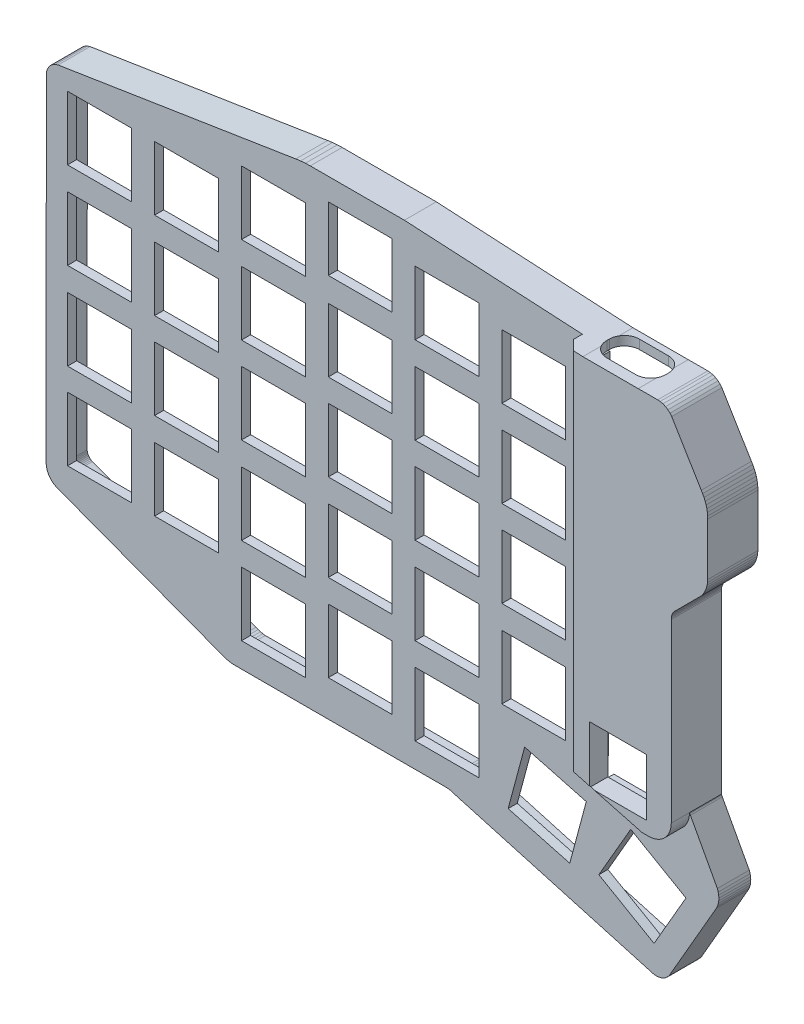
from build123d import *

# Parameters (mm, degrees)
CONTOUR_DEPTH          = 2
CONTOUR_DEPTH_BACK     = 5
ESQUISSE2_W            = 16.1
ESQUISSE2_H            = 14.1
ESQUISSE2_W_2          = 14
ESQUISSE2_H_2          = 14
ESQUISSE2_W_3          = 14.025441
PLATEAU_DEPTH          = 2
ENLEV_PSOM_DEPTH       = 2
ENLEV_START            = -0.5
ESQUISSE4_W            = 8
ESQUISSE4_H            = 8
ENLEV_SR_DEPTH         = 181.12573089
ENLEV_USB_DEPTH        = 10
ESQUISSE9_W            = 12.5
ESQUISSE9_H            = 12.5
BOSS_EXTRU_1_DEPTH     = 4
ENLEV_USB_2_DEPTH      = 2
ENLEV_USB_2_DEPTH_BACK = 2
ESQUISSE8_W            = 12.3
ESQUISSE8_H            = 7.2
ENLEV_USB_3_DEPTH      = 2
CHANFREIN1_SIZE        = 2


with BuildPart() as part:
    # Esquisse1 → Contour (new, two sides: drawn at the far end of the back side and taken through both)
    with BuildSketch(Plane.XY.offset(1.58).offset(-CONTOUR_DEPTH_BACK)):
        Polygon((-0.070669069, -78.010400076), (35.891181454, -91.546056984), (36.410466692, -91.772415512), (37.093081584, -91.996688133), (37.793675302, -92.156155293), (38.544269443, -92.254417), (85.559404107, -92.254417), (85.877019494, -92.291366072), (86.239984785, -92.359141634), (86.597404622, -92.451698185), (87.062965798, -92.607121854), (130.86251782, -104.975260433), (131.43389169, -105.033093447), (131.994682702, -104.998446027), (132.542465338, -104.873481826), (133.062796424, -104.661502855), (133.541959027, -104.368091177), (133.967370901, -104.000936506), (134.335210756, -103.560758555), (144.734398643, -85.501681055), (144.949646628, -85.009048728), (145.107093294, -84.483870396), (145.200181585, -83.943565594), (145.227558424, -83.395976689), (145.18882232, -82.849072108), (145.084548391, -82.310863798), (144.896135329, -81.72665786), (138.983739314, -70.76833766), (138.852004091, -70.547015883), (138.810158784, -70.455662307), (138.781143, -70.368736334), (138.781143, -31.647833224), (138.795598839, -31.333548136), (138.832202844, -31.069781849), (138.892866137, -30.810487886), (138.977076259, -30.557858099), (139.084122245, -30.314024401), (139.213099553, -30.081048074), (139.305959271, -29.94459521), (145.382897496, -23.867656985), (145.765390331, -23.341253838), (146.062952091, -22.83813426), (146.311833426, -22.309238734), (146.509825283, -21.759263203), (146.65516711, -21.193092489), (146.746570537, -20.615755138), (146.781143, -20.065465237), (146.781143, -8.577539054), (146.768717011, -7.985190432), (146.705324445, -7.337390513), (146.592563495, -6.696337408), (146.431093228, -6.065790435), (146.221862613, -5.449443714), (145.966095227, -4.850906853), (145.665297611, -4.273701659), (145.371606939, -3.802084291), (138.873582537, 6.969270257), (138.501879109, 7.430251399), (138.038800394, 7.843967596), (137.514705619, 8.177029924), (136.943495806, 8.420600285), (136.340315392, 8.568220772), (135.807638993, 8.609297951), (131.513464945, 8.592943), (129.917464, 8.592943), (120.917464, 8.592943), (119.374655601, 8.592943), (76.213775601, 10.945583), (55.546780356, 10.945583), (54.487809548, 10.910917492), (53.412263261, 10.82000144), (52.375252365, 10.678150275), (0.212293698, 2.452452946), (-0.337448162, 2.286696078), (-0.896715628, 1.992876271), (-1.390081178, 1.59827241), (-1.799609576, 1.117233202), (-2.110431737, 0.567226717), (-2.311289019, -0.031881124), (-2.386546014, -0.596632339), (-2.413633698, -74.604297371), (-2.36544505, -75.107796481), (-2.232957994, -75.649095831), (-2.023839154, -76.165648062), (-1.742460222, -76.646668805), (-1.394690715, -77.082115184), (-0.987799519, -77.462892806), (-0.530080186, -77.781190629), align=None)
        Polygon((-0.386594572, -0.729667254), (-0.413598748, -74.509173208), (-0.388345002, -74.773036975), (-0.324744666, -75.032887421), (-0.224357103, -75.280858479), (-0.089280963, -75.5117728), (0.077666156, -75.720809294), (0.272995261, -75.903602515), (0.492639991, -76.056343363), (0.73014814, -76.174840956), (36.643525784, -89.69225319), (37.123753652, -89.901586453), (37.628328647, -90.067364197), (38.146192157, -90.185238823), (38.674625212, -90.254417), (85.67534591, -90.254417), (86.176481881, -90.312715527), (86.674742133, -90.405754364), (87.165426887, -90.532820866), (87.65170599, -90.695161041), (131.237818944, -103.003028592), (131.473188176, -103.026852069), (131.708718224, -103.012300287), (131.938786921, -102.959815325), (132.157326496, -102.870783945), (132.358573287, -102.747551961), (132.537221471, -102.593368405), (132.68889956, -102.411861836), (142.946003745, -84.599524812), (143.068580316, -84.318987082), (143.156642538, -84.025247162), (143.208708647, -83.723044076), (143.224020877, -83.416770319), (143.202355349, -83.110880577), (143.144028019, -82.809824943), (143.048943587, -82.514999898), (137.243591396, -71.755079889), (137.078439242, -71.477615994), (136.947084704, -71.190852491), (136.847216761, -70.891666428), (136.781143, -70.588782336), (136.781143, -31.601861582), (136.80193804, -31.149755626), (136.863832516, -30.703747707), (136.966408864, -30.265304185), (137.108800774, -29.838129433), (137.289805821, -29.425828781), (137.507895217, -29.031886099), (137.758515203, -28.663612153), (143.857417024, -22.564710333), (144.091957635, -22.241925421), (144.293469147, -21.901208298), (144.462013973, -21.543035178), (144.59609549, -21.170587772), (144.694522243, -20.787172023), (144.756421454, -20.396194054), (144.781143, -20.002701202), (144.781143, -8.598514241), (144.770763667, -8.103730021), (144.722293545, -7.608420501), (144.636076357, -7.118270353), (144.512615868, -6.636152878), (144.352637267, -6.164891605), (144.157076916, -5.707248898), (143.927081791, -5.265907698), (143.666403188, -4.847302109), (137.231311549, 5.819732869), (137.047533291, 6.047651971), (136.828173352, 6.243628933), (136.579909791, 6.401400473), (136.309329324, 6.516779061), (136.0236074, 6.586705751), (135.734441857, 6.609004664), (131.517273569, 6.592943), (129.917464, 6.592943), (120.917464, 6.592943), (119.32018741, 6.592943), (76.15930741, 8.945583), (55.579506684, 8.945583), (54.60483474, 8.913677023), (53.63216587, 8.831457211), (52.666576779, 8.699375727), (0.658816843, 0.498152045), (0.423228183, 0.427117908), (0.202969732, 0.311401727), (0.008667563, 0.155994877), (-0.152618551, -0.033454609), (-0.275030083, -0.250064442), (-0.354120429, -0.485971482), align=None, mode=Mode.SUBTRACT)
    extrude(amount=CONTOUR_DEPTH + CONTOUR_DEPTH_BACK)

    # Esquisse2 → Plateau (add)
    with BuildSketch(Plane.XY.offset(1.58)):
        Polygon((-0.386594572, -0.729667254), (-0.413598748, -74.509173208), (-0.388345002, -74.773036975), (-0.324744666, -75.032887421), (-0.224357103, -75.280858479), (-0.089280963, -75.5117728), (0.077666156, -75.720809294), (0.272995261, -75.903602515), (0.492639991, -76.056343363), (0.73014814, -76.174840956), (36.643525784, -89.69225319), (37.123753652, -89.901586453), (37.628328647, -90.067364197), (38.146192157, -90.185238823), (38.674625212, -90.254417), (85.67534591, -90.254417), (86.176481881, -90.312715527), (86.674742133, -90.405754364), (87.165426887, -90.532820866), (87.65170599, -90.695161041), (131.237818944, -103.003028592), (131.473188176, -103.026852069), (131.708718224, -103.012300287), (131.938786921, -102.959815325), (132.157326496, -102.870783945), (132.358573287, -102.747551961), (132.537221471, -102.593368405), (132.68889956, -102.411861836), (142.946003745, -84.599524812), (143.068580316, -84.318987082), (143.156642538, -84.025247162), (143.208708647, -83.723044076), (143.224020877, -83.416770319), (143.202355349, -83.110880577), (143.144028019, -82.809824943), (143.048943587, -82.514999898), (137.243591396, -71.755079889), (137.078439242, -71.477615994), (136.947084704, -71.190852491), (136.847216761, -70.891666428), (136.781143, -70.588782336), (136.781143, -31.601861582), (136.80193804, -31.149755626), (136.863832516, -30.703747707), (136.966408864, -30.265304185), (137.108800774, -29.838129433), (137.289805821, -29.425828781), (137.507895217, -29.031886099), (137.758515203, -28.663612153), (143.857417024, -22.564710333), (144.091957635, -22.241925421), (144.293469147, -21.901208298), (144.462013973, -21.543035178), (144.59609549, -21.170587772), (144.694522243, -20.787172023), (144.756421454, -20.396194054), (144.781143, -20.002701202), (144.781143, -8.598514241), (144.770763667, -8.103730021), (144.722293545, -7.608420501), (144.636076357, -7.118270353), (144.512615868, -6.636152878), (144.352637267, -6.164891605), (144.157076916, -5.707248898), (143.927081791, -5.265907698), (143.666403188, -4.847302109), (137.231311549, 5.819732869), (137.047533291, 6.047651971), (136.828173352, 6.243628933), (136.579909791, 6.401400473), (136.309329324, 6.516779061), (136.0236074, 6.586705751), (135.734441857, 6.609004664), (131.517273569, 6.592943), (119.32018741, 6.592943), (76.15930741, 8.945583), (55.579506684, 8.945583), (54.60483474, 8.913677023), (53.63216587, 8.831457211), (52.666576779, 8.699375727), (0.658816843, 0.498152045), (0.423228183, 0.427117908), (0.202969732, 0.311401727), (0.008667563, 0.155994877), (-0.152618551, -0.033454609), (-0.275030083, -0.250064442), (-0.354120429, -0.485971482), align=None)
        with Locations((127.106143, -66.299563)):
            Rectangle(ESQUISSE2_W, ESQUISSE2_H, mode=Mode.SUBTRACT)
        with Locations((9.281143, -8.499563)):
            Rectangle(ESQUISSE2_W_2, ESQUISSE2_H_2, mode=Mode.SUBTRACT)
        with Locations((28.3938635, -8.499563)):
            Rectangle(ESQUISSE2_W_3, ESQUISSE2_H_2, mode=Mode.SUBTRACT)
        with Locations((28.3938635, -27.604417)):
            Rectangle(ESQUISSE2_W_3, ESQUISSE2_H_2, mode=Mode.SUBTRACT)
        with Locations((9.281143, -27.604417)):
            Rectangle(ESQUISSE2_W_2, ESQUISSE2_H_2, mode=Mode.SUBTRACT)
        with Locations((9.281143, -46.749563)):
            Rectangle(ESQUISSE2_W_2, ESQUISSE2_H_2, mode=Mode.SUBTRACT)
        with Locations((28.381143, -46.599563)):
            Rectangle(ESQUISSE2_W_2, ESQUISSE2_H_2, mode=Mode.SUBTRACT)
        with Locations((28.3938635, -65.704417)):
            Rectangle(ESQUISSE2_W_3, ESQUISSE2_H_2, mode=Mode.SUBTRACT)
        with Locations((9.281143, -65.699563)):
            Rectangle(ESQUISSE2_W_2, ESQUISSE2_H_2, mode=Mode.SUBTRACT)
        with Locations((47.456584, -60.804417)):
            Rectangle(ESQUISSE2_W_2, ESQUISSE2_H_2, mode=Mode.SUBTRACT)
        with Locations((47.456584, -79.854417)):
            Rectangle(ESQUISSE2_W_2, ESQUISSE2_H_2, mode=Mode.SUBTRACT)
        with Locations((47.456584, -41.699563)):
            Rectangle(ESQUISSE2_W_2, ESQUISSE2_H_2, mode=Mode.SUBTRACT)
        with Locations((47.456584, -22.699563)):
            Rectangle(ESQUISSE2_W_2, ESQUISSE2_H_2, mode=Mode.SUBTRACT)
        with Locations((47.456584, -3.599563)):
            Rectangle(ESQUISSE2_W_2, ESQUISSE2_H_2, mode=Mode.SUBTRACT)
        with Locations((66.506584, -0.899563)):
            Rectangle(ESQUISSE2_W_2, ESQUISSE2_H_2, mode=Mode.SUBTRACT)
        with Locations((66.506584, -20.199563)):
            Rectangle(ESQUISSE2_W_2, ESQUISSE2_H_2, mode=Mode.SUBTRACT)
        with Locations((66.506584, -39.199563)):
            Rectangle(ESQUISSE2_W_2, ESQUISSE2_H_2, mode=Mode.SUBTRACT)
        with Locations((66.506584, -58.304417)):
            Rectangle(ESQUISSE2_W_2, ESQUISSE2_H_2, mode=Mode.SUBTRACT)
        with Locations((66.506584, -77.354417)):
            Rectangle(ESQUISSE2_W_2, ESQUISSE2_H_2, mode=Mode.SUBTRACT)
        with Locations((85.556584, -79.854417)):
            Rectangle(ESQUISSE2_W_2, ESQUISSE2_H_2, mode=Mode.SUBTRACT)
        with Locations((85.556584, -60.804417)):
            Rectangle(ESQUISSE2_W_2, ESQUISSE2_H_2, mode=Mode.SUBTRACT)
        with Locations((85.556584, -41.699563)):
            Rectangle(ESQUISSE2_W_2, ESQUISSE2_H_2, mode=Mode.SUBTRACT)
        with Locations((85.556584, -22.699563)):
            Rectangle(ESQUISSE2_W_2, ESQUISSE2_H_2, mode=Mode.SUBTRACT)
        with Locations((85.556584, -3.599563)):
            Rectangle(ESQUISSE2_W_2, ESQUISSE2_H_2, mode=Mode.SUBTRACT)
        with Locations((104.606584, -6.149563)):
            Rectangle(ESQUISSE2_W_2, ESQUISSE2_H_2, mode=Mode.SUBTRACT)
        with Locations((104.606584, -25.199563)):
            Rectangle(ESQUISSE2_W_2, ESQUISSE2_H_2, mode=Mode.SUBTRACT)
        with Locations((104.606584, -44.199563)):
            Rectangle(ESQUISSE2_W_2, ESQUISSE2_H_2, mode=Mode.SUBTRACT)
        with Locations((104.606584, -63.304417)):
            Rectangle(ESQUISSE2_W_2, ESQUISSE2_H_2, mode=Mode.SUBTRACT)
        Polygon((116.1297981, -79.604669532), (112.506331468, -93.1276311), (98.9833699, -89.504164468), (102.606836532, -75.9812029), align=None, mode=Mode.SUBTRACT)
        Polygon((125.884406174, -79.992239174), (138.008761826, -86.992239174), (131.008761826, -99.116594826), (118.884406174, -92.116594826), align=None, mode=Mode.SUBTRACT)
    extrude(amount=PLATEAU_DEPTH)

    # Esquisse3 → Enlev PSoM (cut)
    with BuildSketch(Plane.XY.offset(3.58)):
        Polygon((129.305950383, -28.586471751), (129.611143, -28.610490637), (129.916335617, -28.586471751), (130.214012846, -28.515005143), (130.49684507, -28.397852636), (130.757870017, -28.237896494), (130.990656959, -28.039076959), (131.189476494, -27.806290017), (131.349432636, -27.54526507), (131.466585143, -27.262432846), (131.538051751, -26.964755617), (131.561143, -26.671349888), (131.561143, -25.459563), (138.625881293, -25.459563), (138.865042988, -25.436007246), (139.109186039, -25.361948191), (139.334190399, -25.24168089), (139.531408467, -25.079828467), (139.69326089, -24.882610399), (139.813528191, -24.657606039), (139.887587246, -24.413462988), (139.911143, -24.174301293), (139.911143, -9.909563), (141.122929888, -9.909563), (141.416335617, -9.886471751), (141.714012846, -9.815005143), (141.99684507, -9.697852636), (142.257870017, -9.537896494), (142.490656959, -9.339076959), (142.689476494, -9.106290017), (142.849432636, -8.84526507), (142.966585143, -8.562432846), (143.038051751, -8.264755617), (143.062070637, -7.959563), (143.038051751, -7.654370383), (142.966585143, -7.356693154), (142.849432636, -7.07386093), (142.689476494, -6.812835983), (142.490656959, -6.580049041), (142.257870017, -6.381229506), (141.99684507, -6.221273364), (141.714012846, -6.104120857), (141.416335617, -6.032654249), (141.122929888, -6.009563), (139.889969497, -6.009563), (139.836439564, -5.788907139), (139.721636397, -5.541430706), (139.560755727, -5.321107291), (139.359983832, -5.136405573), (139.127034963, -4.994423015), (138.88429, -4.905532248), (138.88429, -3.997381825), (139.026851937, -3.902124937), (139.162524548, -3.699076626), (139.257053649, -3.223854361), (138.90919218, -3.15466082), (138.90429, -3.130015749), (138.90429, -2.289708785), (138.909376765, -2.264653534), (139.21429, -2.213088733), (139.21429, -1.249563), (138.86429, -0.409563), (132.248003523, -0.409563), (131.92429, -1.254033061), (131.92429, -2.20576692), (132.21938782, -2.26446518), (132.22429, -2.289110251), (132.22429, -3.130015749), (132.21938782, -3.15466082), (131.871526351, -3.223854361), (131.966055452, -3.699076626), (132.101728063, -3.902124937), (132.24429, -3.997381825), (132.24429, -4.859563), (120.585909059, -4.859563), (120.323616881, -4.904001842), (120.071002818, -5.000293237), (119.842029165, -5.144017005), (119.64549327, -5.329649525), (119.488948828, -5.550058212), (119.378412411, -5.796771952), (119.329739266, -6.009563), (118.099356112, -6.009563), (117.805950383, -6.032654249), (117.508273154, -6.104120857), (117.22544093, -6.221273364), (116.964415983, -6.381229506), (116.731629041, -6.580049041), (116.532809506, -6.812835983), (116.372853364, -7.07386093), (116.255700857, -7.356693154), (116.184234249, -7.654370383), (116.160215363, -7.959563), (116.184234249, -8.264755617), (116.255700857, -8.562432846), (116.372853364, -8.84526507), (116.532809506, -9.106290017), (116.731629041, -9.339076959), (116.964415983, -9.537896494), (117.22544093, -9.697852636), (117.508273154, -9.815005143), (117.805950383, -9.886471751), (118.099356112, -9.909563), (119.311143, -9.909563), (119.311143, -24.174301293), (119.334698754, -24.413462988), (119.408757809, -24.657606039), (119.52902511, -24.882610399), (119.690877533, -25.079828467), (119.888095601, -25.24168089), (120.113099961, -25.361948191), (120.357243012, -25.436007246), (120.596404707, -25.459563), (127.661143, -25.459563), (127.661143, -26.671349888), (127.684234249, -26.964755617), (127.755700857, -27.262432846), (127.872853364, -27.54526507), (128.032809506, -27.806290017), (128.231629041, -28.039076959), (128.464415983, -28.237896494), (128.72544093, -28.397852636), (129.008273154, -28.515005143), align=None)
    extrude(amount=-ENLEV_PSOM_DEPTH, mode=Mode.SUBTRACT)

    # Esquisse4 → Enlev SR (cut, through all)
    with BuildSketch(Plane.XY.offset(3.58).offset(ENLEV_START)):
        with Locations((116.181143, -16.407057)):
            Rectangle(ESQUISSE4_W, ESQUISSE4_H)
        with Locations((116.181143, -35.907057)):
            Rectangle(ESQUISSE4_W, ESQUISSE4_H)
        with Locations((116.181143, -54.407057)):
            Rectangle(ESQUISSE4_W, ESQUISSE4_H)
        with Locations((116.181143, -74.407057)):
            Rectangle(ESQUISSE4_W, ESQUISSE4_H)
    extrude(amount=-ENLEV_SR_DEPTH, mode=Mode.SUBTRACT)

    # Esquisse6 → Enlev USB (cut)
    with BuildSketch(Plane(origin=(0, 8.592943, 0), x_dir=(1, 0, 0), z_dir=(0, 1, 0))):
        with BuildLine():
            Line((122.227464, -0.025), (128.607464, -0.025))
            ThreePointArc((128.607464, -0.025), (129.51256068, -0.39990332), (129.887464, -1.305))
            Line((129.887464, -1.305), (129.887464, -1.905))
            ThreePointArc((129.887464, -1.905), (129.51256068, -2.81009668), (128.607464, -3.185))
            Line((128.607464, -3.185), (122.227464, -3.185))
            ThreePointArc((122.227464, -3.185), (121.32236732, -2.81009668), (120.947464, -1.905))
            Line((120.947464, -1.905), (120.947464, -1.305))
            ThreePointArc((120.947464, -1.305), (121.32236732, -0.39990332), (122.227464, -0.025))
        make_face()
        with BuildLine():
            Line((122.227464, 0.175), (128.607464, 0.175))
            ThreePointArc((128.607464, 0.175), (129.653982036, -0.258481964), (130.087464, -1.305))
            Line((130.087464, -1.305), (130.087464, -1.905))
            ThreePointArc((130.087464, -1.905), (129.653982036, -2.951518036), (128.607464, -3.385))
            Line((128.607464, -3.385), (122.227464, -3.385))
            ThreePointArc((122.227464, -3.385), (121.180945964, -2.951518036), (120.747464, -1.905))
            Line((120.747464, -1.905), (120.747464, -1.305))
            ThreePointArc((120.747464, -1.305), (121.180945964, -0.258481964), (122.227464, 0.175))
        make_face()
    extrude(amount=-ENLEV_USB_DEPTH, mode=Mode.SUBTRACT)

    # Esquisse9 → Boss.-Extru.1 (add)
    with BuildSketch(Plane.XY.offset(3.58)):
        with BuildLine():
            Line((115.281143, 8.816074722), (115.281143, -72.849563))
            Line((115.281143, -72.849563), (124.611270019, -75.349563))
            Line((124.611270019, -75.349563), (133.800316334, -75.349563))
            ThreePointArc((133.800316334, -75.349563), (137.322292645, -73.890712645), (138.781143, -70.368736334))
            Line((138.781143, -70.368736334), (138.781143, -31.647833224))
            Line((138.781143, -31.647833224), (138.795598839, -31.333548136))
            Line((138.795598839, -31.333548136), (138.832202844, -31.069781849))
            Line((138.832202844, -31.069781849), (138.892866137, -30.810487886))
            Line((138.892866137, -30.810487886), (138.977076259, -30.557858099))
            Line((138.977076259, -30.557858099), (139.084122245, -30.314024401))
            Line((139.084122245, -30.314024401), (139.213099553, -30.081048074))
            Line((139.213099553, -30.081048074), (139.305959271, -29.94459521))
            Line((139.305959271, -29.94459521), (145.382897496, -23.867656985))
            Line((145.382897496, -23.867656985), (145.765390331, -23.341253838))
            Line((145.765390331, -23.341253838), (146.062952091, -22.83813426))
            Line((146.062952091, -22.83813426), (146.311833426, -22.309238734))
            Line((146.311833426, -22.309238734), (146.509825283, -21.759263203))
            Line((146.509825283, -21.759263203), (146.65516711, -21.193092489))
            Line((146.65516711, -21.193092489), (146.746570537, -20.615755138))
            Line((146.746570537, -20.615755138), (146.781143, -20.065465237))
            Line((146.781143, -20.065465237), (146.781143, -8.577539054))
            Line((146.781143, -8.577539054), (146.768717011, -7.985190432))
            Line((146.768717011, -7.985190432), (146.705324445, -7.337390513))
            Line((146.705324445, -7.337390513), (146.592563495, -6.696337408))
            Line((146.592563495, -6.696337408), (146.431093228, -6.065790435))
            Line((146.431093228, -6.065790435), (146.221862613, -5.449443714))
            Line((146.221862613, -5.449443714), (145.966095227, -4.850906853))
            Line((145.966095227, -4.850906853), (145.665297611, -4.273701659))
            Line((145.665297611, -4.273701659), (145.371606939, -3.802084291))
            Line((145.371606939, -3.802084291), (138.873582537, 6.969270257))
            Line((138.873582537, 6.969270257), (138.501879109, 7.430251399))
            Line((138.501879109, 7.430251399), (138.038800394, 7.843967596))
            Line((138.038800394, 7.843967596), (137.514705619, 8.177029924))
            Line((137.514705619, 8.177029924), (136.943495806, 8.420600285))
            Line((136.943495806, 8.420600285), (136.340315392, 8.568220772))
            Line((136.340315392, 8.568220772), (135.807638993, 8.609297951))
            Line((135.807638993, 8.609297951), (131.513464945, 8.592943))
            Line((131.513464945, 8.592943), (119.374655601, 8.592943))
            Line((119.374655601, 8.592943), (115.281143, 8.816074722))
        make_face()
        with Locations((127.106143, -66.299563)):
            Rectangle(ESQUISSE9_W, ESQUISSE9_H, mode=Mode.SUBTRACT)
    extrude(amount=BOSS_EXTRU_1_DEPTH)

    # Esquisse7 → Enlev USB 2 (cut, two sides: drawn at the far end of the back side and taken through both)
    with BuildSketch(Plane(origin=(0, 8.592943, 0), x_dir=(1, 0, 0), z_dir=(0, 1, 0)).offset(-ENLEV_USB_2_DEPTH_BACK)):
        with BuildLine():
            Line((118.947464, -1.305), (118.947464, -1.905))
            ThreePointArc((118.947464, -1.905), (119.908153758, -4.224310242), (122.227464, -5.185))
            Line((122.227464, -5.185), (128.607464, -5.185))
            ThreePointArc((128.607464, -5.185), (130.926774242, -4.224310242), (131.887464, -1.905))
            Line((131.887464, -1.905), (131.887464, -1.305))
            ThreePointArc((131.887464, -1.305), (130.926774242, 1.014310242), (128.607464, 1.975))
            Line((128.607464, 1.975), (122.227464, 1.975))
            ThreePointArc((122.227464, 1.975), (119.908153758, 1.014310242), (118.947464, -1.305))
        make_face()
    extrude(amount=ENLEV_USB_2_DEPTH + ENLEV_USB_2_DEPTH_BACK, mode=Mode.SUBTRACT)

    # Esquisse8 → Enlev USB 3 (cut)
    with BuildSketch(Plane(origin=(0, 0, 1.58), x_dir=(-1, 0, 0), z_dir=(0, 0, -1))):
        with Locations((-125.47018741, 2.992943)):
            Rectangle(ESQUISSE8_W, ESQUISSE8_H)
    extrude(amount=-ENLEV_USB_3_DEPTH, mode=Mode.SUBTRACT)

    # Chanfrein1
    # the kernel refuses this chamfer: 2 mm, written as the material it takes off along each edge
    with BuildSketch(Plane(origin=(115.281143, 13.959440698, 7.58), x_dir=(0, 0, -1), z_dir=(0, -1, 0))) as chanfrein1_piece_1:
        Polygon((CHANFREIN1_SIZE, 0), (0, CHANFREIN1_SIZE), (0, 0), align=None)
    extrude(amount=91.952369674, mode=Mode.SUBTRACT)
    with BuildSketch(Plane(origin=(110.31303297, -71.518361929, 7.58), x_dir=(0, 0, -1), z_dir=(0.965925826288944, -0.25881904510298487, 0))) as chanfrein1_piece_2:
        Polygon((CHANFREIN1_SIZE, 0), (0, CHANFREIN1_SIZE), (0, 0), align=None)
    extrude(amount=23.546346398, mode=Mode.SUBTRACT)


solid = part.part
